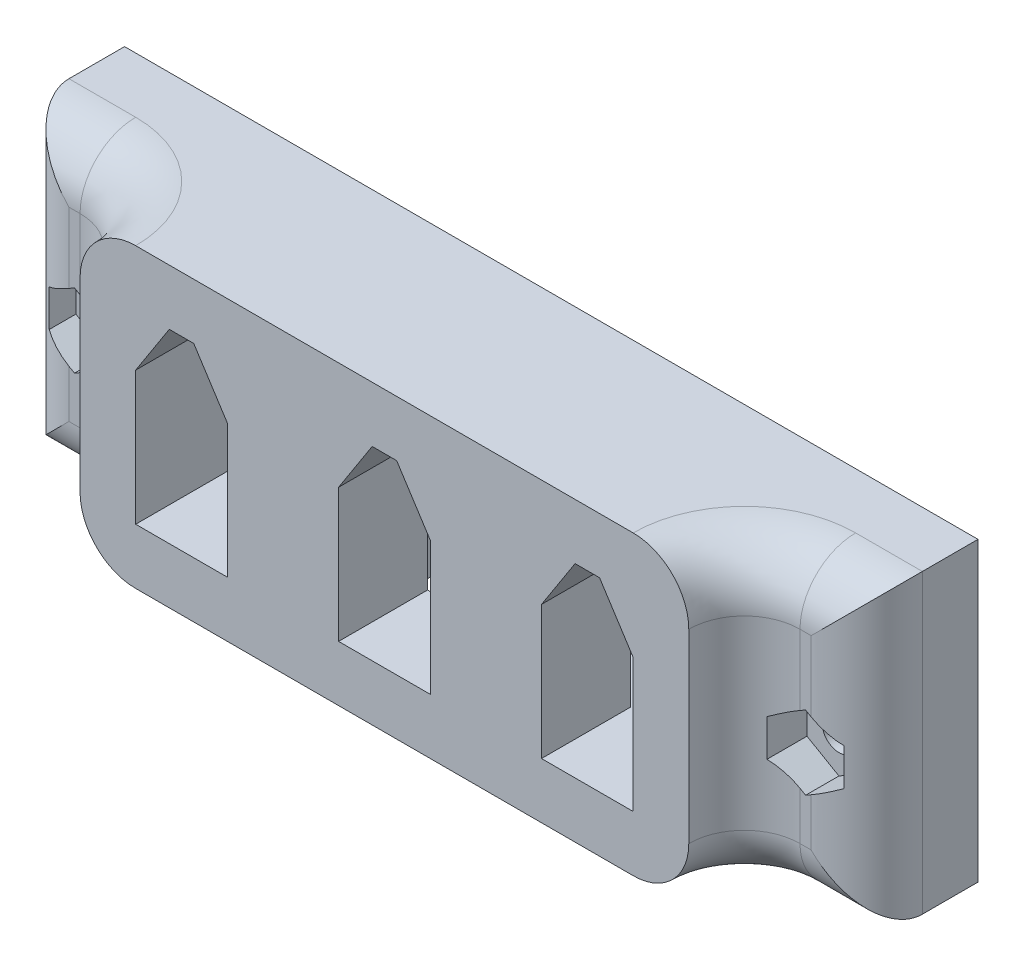
from build123d import *

# Parameters (mm, degrees)
SKETCH1_W           = 76.72
SKETCH1_H           = 26.686
BOSS_EXTRUDE1_DEPTH = 15
SKETCH2_W           = 11
SKETCH2_H           = 5
CUT_EXTRUDE1_DEPTH  = 69.000448499
SKETCH3_R           = 1.5
CUT_EXTRUDE2_DEPTH  = 25
CUT_EXTRUDE3_DEPTH  = 3
CUT_EXTRUDE5_DEPTH  = 7
FILLET1_R           = 5


with BuildPart() as part:
    # Sketch1 → Boss-Extrude1 (new body)
    with BuildSketch(Plane.XY):
        with Locations((22.36, 8.343)):
            Rectangle(SKETCH1_W, SKETCH1_H)
        Polygon((0, 0), (0, 12), (3.02, 16.686), (5.22, 16.686), (8.24, 12), (8.24, 0), align=None, mode=Mode.SUBTRACT)
        Polygon((23.46, 16.686), (26.48, 12), (26.48, 0), (18.24, 0), (18.24, 12), (21.26, 16.686), align=None, mode=Mode.SUBTRACT)
        Polygon((41.7, 16.686), (44.72, 12), (44.72, 0), (36.48, 0), (36.48, 12), (39.5, 16.686), align=None, mode=Mode.SUBTRACT)
    extrude(amount=BOSS_EXTRUDE1_DEPTH)

    # Sketch2 → Cut-Extrude1 (cut, through all)
    with BuildSketch(Plane(origin=(0, -5, 0), x_dir=(-1, 0, 0), z_dir=(0, -1, 0))):
        with Locations((10.5, -12.5)):
            Rectangle(SKETCH2_W, SKETCH2_H)
        with Locations((-55.22, -12.5)):
            Rectangle(SKETCH2_W, SKETCH2_H)
    extrude(amount=-CUT_EXTRUDE1_DEPTH, mode=Mode.SUBTRACT)

    # Sketch3 → Cut-Extrude2 (cut)
    with BuildSketch(Plane.XY.offset(10)):
        with Locations((-10.5, 7.331502285)):
            Circle(SKETCH3_R)
        with Locations((55.22, 7.331502285)):
            Circle(SKETCH3_R)
    extrude(amount=-CUT_EXTRUDE2_DEPTH, mode=Mode.SUBTRACT)

    # Sketch4 → Cut-Extrude3 (cut)
    with BuildSketch(Plane.XY.offset(10)):
        Polygon((-10.5, 10.651266332), (-13.375, 8.991384309), (-13.375, 5.671620261), (-10.5, 4.011738237), (-7.625, 5.671620261), (-7.625, 8.991384309), align=None)
        Polygon((55.22, 10.651266332), (52.345, 8.991384309), (52.345, 5.671620261), (55.22, 4.011738237), (58.095, 5.671620261), (58.095, 8.991384309), align=None)
    extrude(amount=-CUT_EXTRUDE3_DEPTH, mode=Mode.SUBTRACT)

    # Sketch7 → Cut-Extrude5 (cut)
    with BuildSketch(Plane(origin=(0, 0, 0), x_dir=(-1, 0, 0), z_dir=(0, 0, -1))):
        Polygon((0, 0), (-12.36, 0), (-12.36, -5), (-32.36, -5), (-32.36, 0), (-44.72, 0), (-44.72, 16.686), (0, 16.686), align=None)
    extrude(amount=-CUT_EXTRUDE5_DEPTH, mode=Mode.SUBTRACT)

    # Fillet1
    # the kernel refuses this fillet: 5 mm, written as the material it adds along each edge
    with BuildSketch(Plane(origin=(49.72, -5, 10), x_dir=(0, 0, 1), z_dir=(0, 1, 0))) as fillet1_piece_1_section:
        with BuildLine():
            CenterArc((FILLET1_R, FILLET1_R), FILLET1_R, 180, 90)
            Line((0, FILLET1_R), (0, 0))
            Line((0, 0), (FILLET1_R, 0))
        make_face()
    fillet1_piece_1 = extrude(amount=26.686, mode=Mode.PRIVATE)
    fillet1_piece_1 = split(fillet1_piece_1, bisect_by=Plane(origin=(52.345, 0.855809372, 11.280904263), z_dir=(-1, 0, 0)), keep=Keep.TOP, mode=Mode.PRIVATE)
    fillet1_piece_1 = split(fillet1_piece_1, bisect_by=Plane(origin=(53.079309625, 5.247666401, 11.280904263), z_dir=(-0.5000000000000012, -0.866025403784438, 0)), keep=Keep.TOP, mode=Mode.PRIVATE)
    add(fillet1_piece_1)
    with BuildSketch(Plane(origin=(49.72, -5, 10), x_dir=(0, 0, 1), z_dir=(0, 1, 0))) as fillet1_piece_2_section:
        with BuildLine():
            CenterArc((FILLET1_R, FILLET1_R), FILLET1_R, 180, 90)
            Line((0, FILLET1_R), (0, 0))
            Line((0, 0), (FILLET1_R, 0))
        make_face()
    fillet1_piece_2 = extrude(amount=26.686, mode=Mode.PRIVATE)
    fillet1_piece_2 = split(fillet1_piece_2, bisect_by=Plane(origin=(52.345, 0.113882783, 10.103766802), z_dir=(1, 0, 0)), keep=Keep.TOP, mode=Mode.PRIVATE)
    fillet1_piece_2 = split(fillet1_piece_2, bisect_by=Plane(origin=(55.328155085, 3.94929487, 10.103766802), z_dir=(-0.5000000000000012, -0.866025403784438, 0)), keep=Keep.TOP, mode=Mode.PRIVATE)
    add(fillet1_piece_2)
    with BuildSketch(Plane(origin=(49.72, -5, 10), x_dir=(0, 0, 1), z_dir=(0, 1, 0))) as fillet1_piece_3_section:
        with BuildLine():
            CenterArc((FILLET1_R, FILLET1_R), FILLET1_R, 180, 90)
            Line((0, FILLET1_R), (0, 0))
            Line((0, 0), (FILLET1_R, 0))
        make_face()
    fillet1_piece_3 = extrude(amount=26.686, mode=Mode.PRIVATE)
    fillet1_piece_3 = split(fillet1_piece_3, bisect_by=Plane(origin=(50.660222367, 8.018677488, 10.86123456), z_dir=(0.5000000000000002, -0.8660254037844386, 0)), keep=Keep.TOP, mode=Mode.PRIVATE)
    fillet1_piece_3 = split(fillet1_piece_3, bisect_by=Plane(origin=(52.345, 7.331502285, 10.86123456), z_dir=(-1, 0, 0)), keep=Keep.TOP, mode=Mode.PRIVATE)
    fillet1_piece_3 = split(fillet1_piece_3, bisect_by=Plane(origin=(50.660222367, 6.644327081, 10.86123456), z_dir=(0.5000000000000012, 0.866025403784438, 0)), keep=Keep.TOP, mode=Mode.PRIVATE)
    add(fillet1_piece_3)
    with BuildSketch(Plane(origin=(49.72, -5, 10), x_dir=(0, 0, 1), z_dir=(0, 1, 0))) as fillet1_piece_4_section:
        with BuildLine():
            CenterArc((FILLET1_R, FILLET1_R), FILLET1_R, 180, 90)
            Line((0, FILLET1_R), (0, 0))
            Line((0, 0), (FILLET1_R, 0))
        make_face()
    fillet1_piece_4 = extrude(amount=26.686, mode=Mode.PRIVATE)
    fillet1_piece_4 = split(fillet1_piece_4, bisect_by=Plane(origin=(53.520712077, 9.670181993, 11.277716929), z_dir=(-0.5000000000000002, 0.8660254037844386, 0)), keep=Keep.TOP, mode=Mode.PRIVATE)
    fillet1_piece_4 = split(fillet1_piece_4, bisect_by=Plane(origin=(52.345, 14.819818281, 11.277716929), z_dir=(-1, 0, 0)), keep=Keep.TOP, mode=Mode.PRIVATE)
    add(fillet1_piece_4)
    with BuildSketch(Plane(origin=(49.72, -5, 10), x_dir=(0, 0, 1), z_dir=(0, 1, 0))) as fillet1_piece_5_section:
        with BuildLine():
            CenterArc((FILLET1_R, FILLET1_R), FILLET1_R, 180, 90)
            Line((0, FILLET1_R), (0, 0))
            Line((0, 0), (FILLET1_R, 0))
        make_face()
    fillet1_piece_5 = extrude(amount=26.686, mode=Mode.PRIVATE)
    fillet1_piece_5 = split(fillet1_piece_5, bisect_by=Plane(origin=(55.769242126, 10.968371422, 10.103260702), z_dir=(-0.5000000000000002, 0.8660254037844386, 0)), keep=Keep.TOP, mode=Mode.PRIVATE)
    fillet1_piece_5 = split(fillet1_piece_5, bisect_by=Plane(origin=(52.345, 15.561640812, 10.103260702), z_dir=(1, 0, 0)), keep=Keep.TOP, mode=Mode.PRIVATE)
    add(fillet1_piece_5)
    with BuildSketch(Plane(origin=(-5, -5, 10), x_dir=(-1, 0, 0), z_dir=(0, 1, 0))) as fillet1_piece_6_section:
        with BuildLine():
            CenterArc((FILLET1_R, FILLET1_R), FILLET1_R, 180, 90)
            Line((0, FILLET1_R), (0, 0))
            Line((0, 0), (FILLET1_R, 0))
        make_face()
    fillet1_piece_6 = extrude(amount=26.686, mode=Mode.PRIVATE)
    fillet1_piece_6 = split(fillet1_piece_6, bisect_by=Plane(origin=(-10.608155085, 3.94929487, 10.103766802), z_dir=(0.5000000000000003, -0.8660254037844387, 0)), keep=Keep.TOP, mode=Mode.PRIVATE)
    fillet1_piece_6 = split(fillet1_piece_6, bisect_by=Plane(origin=(-7.625, 0.113882783, 10.103766802), z_dir=(-1, 0, 0)), keep=Keep.TOP, mode=Mode.PRIVATE)
    add(fillet1_piece_6)
    with BuildSketch(Plane(origin=(-5, -5, 10), x_dir=(-1, 0, 0), z_dir=(0, 1, 0))) as fillet1_piece_7_section:
        with BuildLine():
            CenterArc((FILLET1_R, FILLET1_R), FILLET1_R, 180, 90)
            Line((0, FILLET1_R), (0, 0))
            Line((0, 0), (FILLET1_R, 0))
        make_face()
    fillet1_piece_7 = extrude(amount=26.686, mode=Mode.PRIVATE)
    fillet1_piece_7 = split(fillet1_piece_7, bisect_by=Plane(origin=(-8.359309625, 5.247666401, 11.280904263), z_dir=(0.5000000000000003, -0.8660254037844387, 0)), keep=Keep.TOP, mode=Mode.PRIVATE)
    fillet1_piece_7 = split(fillet1_piece_7, bisect_by=Plane(origin=(-7.625, 0.855809372, 11.280904263), z_dir=(1, 0, 0)), keep=Keep.TOP, mode=Mode.PRIVATE)
    add(fillet1_piece_7)
    with BuildSketch(Plane(origin=(-5, -5, 10), x_dir=(-1, 0, 0), z_dir=(0, 1, 0))) as fillet1_piece_8_section:
        with BuildLine():
            CenterArc((FILLET1_R, FILLET1_R), FILLET1_R, 180, 90)
            Line((0, FILLET1_R), (0, 0))
            Line((0, 0), (FILLET1_R, 0))
        make_face()
    fillet1_piece_8 = extrude(amount=26.686, mode=Mode.PRIVATE)
    fillet1_piece_8 = split(fillet1_piece_8, bisect_by=Plane(origin=(-5.940222366, 6.644327081, 10.861234561), z_dir=(-0.5000000000000003, 0.8660254037844387, 0)), keep=Keep.TOP, mode=Mode.PRIVATE)
    fillet1_piece_8 = split(fillet1_piece_8, bisect_by=Plane(origin=(-7.625, 7.331502285, 10.861234561), z_dir=(1, 0, 0)), keep=Keep.TOP, mode=Mode.PRIVATE)
    fillet1_piece_8 = split(fillet1_piece_8, bisect_by=Plane(origin=(-5.940222366, 8.018677488, 10.861234561), z_dir=(-0.49999999999999967, -0.8660254037844388, 0)), keep=Keep.TOP, mode=Mode.PRIVATE)
    add(fillet1_piece_8)
    with BuildSketch(Plane(origin=(-5, -5, 10), x_dir=(-1, 0, 0), z_dir=(0, 1, 0))) as fillet1_piece_9_section:
        with BuildLine():
            CenterArc((FILLET1_R, FILLET1_R), FILLET1_R, 180, 90)
            Line((0, FILLET1_R), (0, 0))
            Line((0, 0), (FILLET1_R, 0))
        make_face()
    fillet1_piece_9 = extrude(amount=26.686, mode=Mode.PRIVATE)
    fillet1_piece_9 = split(fillet1_piece_9, bisect_by=Plane(origin=(-7.625, 15.561640812, 10.103260702), z_dir=(-1, 0, 0)), keep=Keep.TOP, mode=Mode.PRIVATE)
    fillet1_piece_9 = split(fillet1_piece_9, bisect_by=Plane(origin=(-11.049242126, 10.968371422, 10.103260702), z_dir=(0.49999999999999967, 0.8660254037844388, 0)), keep=Keep.TOP, mode=Mode.PRIVATE)
    add(fillet1_piece_9)
    with BuildSketch(Plane(origin=(-5, -5, 10), x_dir=(-1, 0, 0), z_dir=(0, 1, 0))) as fillet1_piece_10_section:
        with BuildLine():
            CenterArc((FILLET1_R, FILLET1_R), FILLET1_R, 180, 90)
            Line((0, FILLET1_R), (0, 0))
            Line((0, 0), (FILLET1_R, 0))
        make_face()
    fillet1_piece_10 = extrude(amount=26.686, mode=Mode.PRIVATE)
    fillet1_piece_10 = split(fillet1_piece_10, bisect_by=Plane(origin=(-7.625, 14.819818281, 11.277716929), z_dir=(1, 0, 0)), keep=Keep.TOP, mode=Mode.PRIVATE)
    fillet1_piece_10 = split(fillet1_piece_10, bisect_by=Plane(origin=(-8.800712077, 9.670181993, 11.277716929), z_dir=(0.49999999999999967, 0.8660254037844388, 0)), keep=Keep.TOP, mode=Mode.PRIVATE)
    add(fillet1_piece_10)
    # the kernel refuses this fillet: 5 mm, written as the material it takes off along each edge
    with BuildSketch(Plane(origin=(60.72, -17.5, 10), x_dir=(0, 0, -1), z_dir=(0, 1, 0)), Plane(origin=(-16, -17.5, 10), x_dir=(1, 0, 0), z_dir=(0, 1, 0))) as fillet1_2_piece_1:
        with BuildLine():
            CenterArc((FILLET1_R, FILLET1_R), FILLET1_R, 180, 90)
            Line((0, FILLET1_R), (0, 0))
            Line((0, 0), (FILLET1_R, 0))
        make_face()
    extrude(amount=51.686, mode=Mode.SUBTRACT)
    with BuildSketch(Plane(origin=(73.22, 21.686, 10), x_dir=(0, 0, -1), z_dir=(-1, 0, 0)), Plane(origin=(-10, 21.686, 10), x_dir=(0, 0, -1), z_dir=(-1, 0, 0))) as fillet1_2_piece_2:
        with BuildLine():
            CenterArc((FILLET1_R, FILLET1_R), FILLET1_R, 180, 90)
            Line((0, FILLET1_R), (0, 0))
            Line((0, 0), (FILLET1_R, 0))
        make_face()
    extrude(amount=18.5, mode=Mode.SUBTRACT)
    with BuildSketch(Plane(origin=(73.22, -5, 10), x_dir=(0, 0, -1), z_dir=(-1, 0, 0)), Plane(origin=(-10, -5, 10), x_dir=(0, 0, -1), z_dir=(-1, 0, 0))) as fillet1_2_piece_3:
        with BuildLine():
            CenterArc((FILLET1_R, -FILLET1_R), FILLET1_R, 90, 90)
            Line((0, -FILLET1_R), (0, 0))
            Line((0, 0), (FILLET1_R, 0))
        make_face()
    extrude(amount=18.5, mode=Mode.SUBTRACT)
    with BuildSketch(Plane(origin=(-10, -5, 15), x_dir=(-0.8017442392976459, 0, 0.5976672776328307), z_dir=(-0.5976672776328307, 0, -0.8017442392976459))) as fillet1_2_piece_4:
        with BuildLine():
            CenterArc((5 + FILLET1_R, FILLET1_R), FILLET1_R, 180, 90)
            Line((5, FILLET1_R), (5, 0))
            Line((5, 0), (5 + FILLET1_R, 0))
        make_face()
    revolve(axis=Axis((-10, -5, 15), (0, 1, 0)), revolution_arc=233.296989237, mode=Mode.SUBTRACT)
    with BuildSketch(Plane(origin=(-10, 21.686, 15), x_dir=(0, 0, -1), z_dir=(-1, 0, 0))) as fillet1_2_piece_5:
        with BuildLine():
            CenterArc((5 + FILLET1_R, FILLET1_R), FILLET1_R, 180, 90)
            Line((5, FILLET1_R), (5, 0))
            Line((5, 0), (5 + FILLET1_R, 0))
        make_face()
    revolve(axis=Axis((-10, 21.686, 15), (0, -1, 0)), revolution_arc=233.296989237, mode=Mode.SUBTRACT)
    with BuildSketch(Plane(origin=(54.72, -5, 15), x_dir=(0, 0, -1), z_dir=(1, 0, 0))) as fillet1_2_piece_6:
        with BuildLine():
            CenterArc((5 + FILLET1_R, FILLET1_R), FILLET1_R, 180, 90)
            Line((5, FILLET1_R), (5, 0))
            Line((5, 0), (5 + FILLET1_R, 0))
        make_face()
    revolve(axis=Axis((54.72, -5, 15), (0, 1, 0)), revolution_arc=233.296989237, mode=Mode.SUBTRACT)
    with BuildSketch(Plane(origin=(54.72, 21.686, 15), x_dir=(0.8017442392976476, 0, 0.5976672776328285), z_dir=(0.5976672776328285, 0, -0.8017442392976476))) as fillet1_2_piece_7:
        with BuildLine():
            CenterArc((5 + FILLET1_R, FILLET1_R), FILLET1_R, 180, 90)
            Line((5, FILLET1_R), (5, 0))
            Line((5, 0), (5 + FILLET1_R, 0))
        make_face()
    revolve(axis=Axis((54.72, 21.686, 15), (0, -1, 0)), revolution_arc=233.296989237, mode=Mode.SUBTRACT)


solid = part.part
